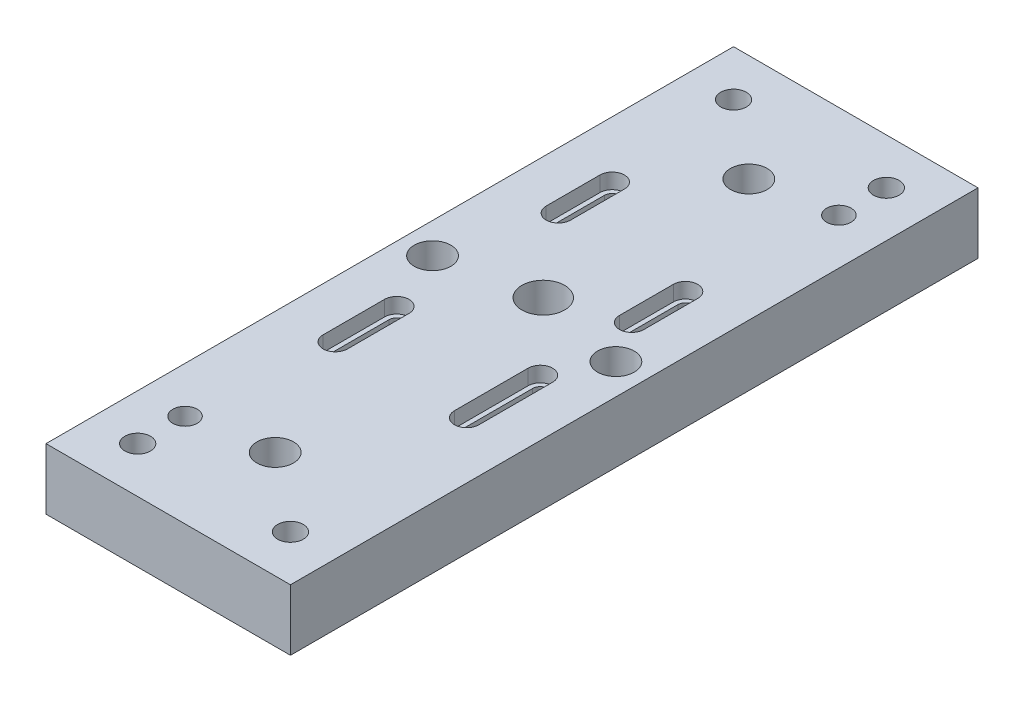
from build123d import *

# Parameters (mm, degrees)
SKETCH1_W                                    = 80
SKETCH1_H                                    = 225
BOSS_EXTRUDE1_DEPTH                          = 20
CUT_EXTRUDE1_REACH                           = 123.063
CUT_EXTRUDE2_DEPTH                           = 5
CBORE_FOR_M8_HEX_SOCKET_HEAD_CAP_SCR_2_COUNT = 2
CBORE_FOR_M8_HEX_SOCKET_HEAD_CAP_SCR_2_PITCH = 50
CBORE_FOR_M8_HEX_SOCKET_HEAD_CAP_SCR_3_COUNT = 2
CBORE_FOR_M8_HEX_SOCKET_HEAD_CAP_SCR_3_PITCH = 201.308221392
CBORE_FOR_M8_HEX_SOCKET_HEAD_CAP_SCR_4_COUNT = 2
CBORE_FOR_M8_HEX_SOCKET_HEAD_CAP_SCR_4_PITCH = 195
F_8_0MM_DOWEL_HOLE1_D                        = 8
SKETCH11_R                                   = 10.5
CUT_EXTRUDE3_DEPTH                           = 14.2
CUT_EXTRUDE4_REACH                           = 123.063
SKETCH13_R                                   = 6
CUT_EXTRUDE5_REACH                           = 123.063
SKETCH14_R                                   = 7


with BuildPart() as part:
    # Sketch1 → Boss-Extrude1 (new body)
    with BuildSketch(Plane(origin=(0, 0, 0), x_dir=(1, 0, 0), z_dir=(0, 1, 0))):
        Rectangle(SKETCH1_W, SKETCH1_H)
    extrude(amount=-BOSS_EXTRUDE1_DEPTH)

    # Sketch2 → Cut-Extrude1 (cut, up to next)
    with BuildSketch(Plane(origin=(0, 0, 0), x_dir=(1, 0, 0), z_dir=(0, 1, 0)), mode=Mode.PRIVATE) as cut_extrude1_sk1:
        with BuildLine():
            Line((24, 17.68), (24, 35.28))
            ThreePointArc((24, 35.28), (21.5, 37.78), (19, 35.28))
            Line((19, 35.28), (19, 17.68))
            ThreePointArc((19, 17.68), (21.5, 15.18), (24, 17.68))
        make_face()
    cut_extrude1_tool1 = extrude(cut_extrude1_sk1.sketch, amount=-CUT_EXTRUDE1_REACH, mode=Mode.PRIVATE) & part.part
    # Sketch2 → Cut-Extrude1 (cut, up to next)
    with BuildSketch(Plane(origin=(0, 0, 0), x_dir=(1, 0, 0), z_dir=(0, 1, 0)), mode=Mode.PRIVATE) as cut_extrude1_sk2:
        with BuildLine():
            Line((24, -36.32), (24, -12.22))
            ThreePointArc((24, -12.22), (21.5, -9.72), (19, -12.22))
            Line((19, -12.22), (19, -36.32))
            ThreePointArc((19, -36.32), (21.5, -38.82), (24, -36.32))
        make_face()
    cut_extrude1_tool2 = extrude(cut_extrude1_sk2.sketch, amount=-CUT_EXTRUDE1_REACH, mode=Mode.PRIVATE) & part.part
    # Sketch2 → Cut-Extrude1 (cut, up to next)
    with BuildSketch(Plane(origin=(0, 0, 0), x_dir=(1, 0, 0), z_dir=(0, 1, 0)), mode=Mode.PRIVATE) as cut_extrude1_sk3:
        with BuildLine():
            Line((-24, -16.22), (-24, -36.32))
            ThreePointArc((-24, -36.32), (-21.5, -38.82), (-19, -36.32))
            Line((-19, -36.32), (-19, -16.22))
            ThreePointArc((-19, -16.22), (-21.5, -13.72), (-24, -16.22))
        make_face()
    cut_extrude1_tool3 = extrude(cut_extrude1_sk3.sketch, amount=-CUT_EXTRUDE1_REACH, mode=Mode.PRIVATE) & part.part
    # Sketch2 → Cut-Extrude1 (cut, up to next)
    with BuildSketch(Plane(origin=(0, 0, 0), x_dir=(1, 0, 0), z_dir=(0, 1, 0)), mode=Mode.PRIVATE) as cut_extrude1_sk4:
        with BuildLine():
            Line((-24, 54.28), (-24, 36.68))
            ThreePointArc((-24, 36.68), (-21.5, 34.18), (-19, 36.68))
            Line((-19, 36.68), (-19, 54.28))
            ThreePointArc((-19, 54.28), (-21.5, 56.78), (-24, 54.28))
        make_face()
    cut_extrude1_tool4 = extrude(cut_extrude1_sk4.sketch, amount=-CUT_EXTRUDE1_REACH, mode=Mode.PRIVATE) & part.part
    add(cut_extrude1_tool1.solids().sort_by_distance((21.5, 0, -26.48))[0], mode=Mode.SUBTRACT)
    add(cut_extrude1_tool2.solids().sort_by_distance((21.5, 0, 24.27))[0], mode=Mode.SUBTRACT)
    add(cut_extrude1_tool3.solids().sort_by_distance((-21.5, 0, 26.27))[0], mode=Mode.SUBTRACT)
    add(cut_extrude1_tool4.solids().sort_by_distance((-21.5, 0, -45.48))[0], mode=Mode.SUBTRACT)

    # Sketch3 → Cut-Extrude2 (cut)
    with BuildSketch(Plane(origin=(0, 0, 0), x_dir=(1, 0, 0), z_dir=(0, 1, 0))):
        with BuildLine():
            Line((-17.5, 36.68), (-17.5, 54.28))
            ThreePointArc((-17.5, 54.28), (-21.5, 58.28), (-25.5, 54.28))
            Line((-25.5, 54.28), (-25.5, 36.68))
            ThreePointArc((-25.5, 36.68), (-21.5, 32.68), (-17.5, 36.68))
        make_face()
        with BuildLine():
            Line((25.5, 17.68), (25.5, 35.28))
            ThreePointArc((25.5, 35.28), (21.5, 39.28), (17.5, 35.28))
            Line((17.5, 35.28), (17.5, 17.68))
            ThreePointArc((17.5, 17.68), (21.5, 13.68), (25.5, 17.68))
        make_face()
        with BuildLine():
            Line((25.5, -36.32), (25.5, -12.22))
            ThreePointArc((25.5, -12.22), (21.5, -8.22), (17.5, -12.22))
            Line((17.5, -12.22), (17.5, -36.32))
            ThreePointArc((17.5, -36.32), (21.5, -40.32), (25.5, -36.32))
        make_face()
        with BuildLine():
            Line((-25.5, -16.22), (-25.5, -36.32))
            ThreePointArc((-25.5, -36.32), (-21.5, -40.32), (-17.5, -36.32))
            Line((-17.5, -36.32), (-17.5, -16.22))
            ThreePointArc((-17.5, -16.22), (-21.5, -12.22), (-25.5, -16.22))
        make_face()
    extrude(amount=-CUT_EXTRUDE2_DEPTH, mode=Mode.SUBTRACT)

    # Sketch6 → CBORE for M8 Hex Socket Head Cap Screw1 (revolve, cut)
    with BuildSketch(Plane(origin=(25, -20, -97.5), x_dir=(0, 0, -1), z_dir=(1, 0, 0))):
        Polygon((0, 0), (0, 20), (4.2, 20), (4.2, 8.6), (7.5, 8.6), (7.5, 0.025), (7.525, 0), align=None)
    cbore_for_m8_hex_socket_head_cap_screw1 = revolve(axis=Axis((25, -26.35, -97.5), (0, 1, 0)), mode=Mode.SUBTRACT)

    # CBORE for M8 Hex Socket Head Cap Scr 2: CBORE for M8 Hex Socket Head Cap Screw1 ×2
    with Locations(*[(-i * CBORE_FOR_M8_HEX_SOCKET_HEAD_CAP_SCR_2_PITCH, 0, 0) for i in range(1, CBORE_FOR_M8_HEX_SOCKET_HEAD_CAP_SCR_2_COUNT)]):
        add(cbore_for_m8_hex_socket_head_cap_screw1, mode=Mode.SUBTRACT)

    # CBORE for M8 Hex Socket Head Cap Scr 3: CBORE for M8 Hex Socket Head Cap Screw1 ×2
    with Locations(*[Vector(-0.24837535026770385, 0, 0.968663866044045) * (i * CBORE_FOR_M8_HEX_SOCKET_HEAD_CAP_SCR_3_PITCH) for i in range(1, CBORE_FOR_M8_HEX_SOCKET_HEAD_CAP_SCR_3_COUNT)]):
        add(cbore_for_m8_hex_socket_head_cap_screw1, mode=Mode.SUBTRACT)

    # CBORE for M8 Hex Socket Head Cap Scr 4: CBORE for M8 Hex Socket Head Cap Screw1 ×2
    with Locations(*[(0, 0, i * CBORE_FOR_M8_HEX_SOCKET_HEAD_CAP_SCR_4_PITCH) for i in range(1, CBORE_FOR_M8_HEX_SOCKET_HEAD_CAP_SCR_4_COUNT)]):
        add(cbore_for_m8_hex_socket_head_cap_screw1, mode=Mode.SUBTRACT)

    # Ø8.0mm Dowel Hole1 (through all)
    with Locations(Plane(origin=(0, -20, 0), x_dir=(-1, 0, 0), z_dir=(0, -1, 0))):
        with Locations((-25, 81.975), (25, -82)):
            Hole(F_8_0MM_DOWEL_HOLE1_D / 2)

    # Sketch11 → Cut-Extrude3 (cut)
    with BuildSketch(Plane.XZ.offset(20)):
        with Locations((-22, 55)):
            Circle(SKETCH11_R)
        with Locations((22, 55)):
            Circle(SKETCH11_R)
        with Locations((-22, -72)):
            Circle(SKETCH11_R)
        with Locations((22, -60)):
            Circle(SKETCH11_R)
        with Locations((0, -35)):
            Circle(SKETCH11_R)
        with Locations((0, 25)):
            Circle(SKETCH11_R)
    extrude(amount=-CUT_EXTRUDE3_DEPTH, mode=Mode.SUBTRACT)

    # Sketch13 → Cut-Extrude4 (cut, up to next)
    with BuildSketch(Plane(origin=(0, 0, 0), x_dir=(1, 0, 0), z_dir=(0, 1, 0)), mode=Mode.PRIVATE) as cut_extrude4_sk1:
        with Locations((0, 77.5)):
            Circle(SKETCH13_R)
    cut_extrude4_tool1 = extrude(cut_extrude4_sk1.sketch, amount=-CUT_EXTRUDE4_REACH, mode=Mode.PRIVATE) & part.part
    # Sketch13 → Cut-Extrude4 (cut, up to next)
    with BuildSketch(Plane(origin=(0, 0, 0), x_dir=(1, 0, 0), z_dir=(0, 1, 0)), mode=Mode.PRIVATE) as cut_extrude4_sk2:
        with Locations((0, -77.5)):
            Circle(SKETCH13_R)
    cut_extrude4_tool2 = extrude(cut_extrude4_sk2.sketch, amount=-CUT_EXTRUDE4_REACH, mode=Mode.PRIVATE) & part.part
    # Sketch13 → Cut-Extrude4 (cut, up to next)
    with BuildSketch(Plane(origin=(0, 0, 0), x_dir=(1, 0, 0), z_dir=(0, 1, 0)), mode=Mode.PRIVATE) as cut_extrude4_sk3:
        with Locations((-30, 4)):
            Circle(SKETCH13_R)
    cut_extrude4_tool3 = extrude(cut_extrude4_sk3.sketch, amount=-CUT_EXTRUDE4_REACH, mode=Mode.PRIVATE) & part.part
    # Sketch13 → Cut-Extrude4 (cut, up to next)
    with BuildSketch(Plane(origin=(0, 0, 0), x_dir=(1, 0, 0), z_dir=(0, 1, 0)), mode=Mode.PRIVATE) as cut_extrude4_sk4:
        with Locations((30, 4)):
            Circle(SKETCH13_R)
    cut_extrude4_tool4 = extrude(cut_extrude4_sk4.sketch, amount=-CUT_EXTRUDE4_REACH, mode=Mode.PRIVATE) & part.part
    add(cut_extrude4_tool1.solids().sort_by_distance((0, 0, -77.5))[0], mode=Mode.SUBTRACT)
    add(cut_extrude4_tool2.solids().sort_by_distance((0, 0, 77.5))[0], mode=Mode.SUBTRACT)
    add(cut_extrude4_tool3.solids().sort_by_distance((-30, 0, -4))[0], mode=Mode.SUBTRACT)
    add(cut_extrude4_tool4.solids().sort_by_distance((30, 0, -4))[0], mode=Mode.SUBTRACT)

    # Sketch14 → Cut-Extrude5 (cut, up to next)
    with BuildSketch(Plane(origin=(0, 0, 0), x_dir=(1, 0, 0), z_dir=(0, 1, 0)), mode=Mode.PRIVATE) as cut_extrude5_sk1:
        with Locations((0, 10.23)):
            Circle(SKETCH14_R)
    cut_extrude5_tool1 = extrude(cut_extrude5_sk1.sketch, amount=-CUT_EXTRUDE5_REACH, mode=Mode.PRIVATE) & part.part
    add(cut_extrude5_tool1.solids().sort_by_distance((0, 0, -10.23))[0], mode=Mode.SUBTRACT)


solid = part.part
